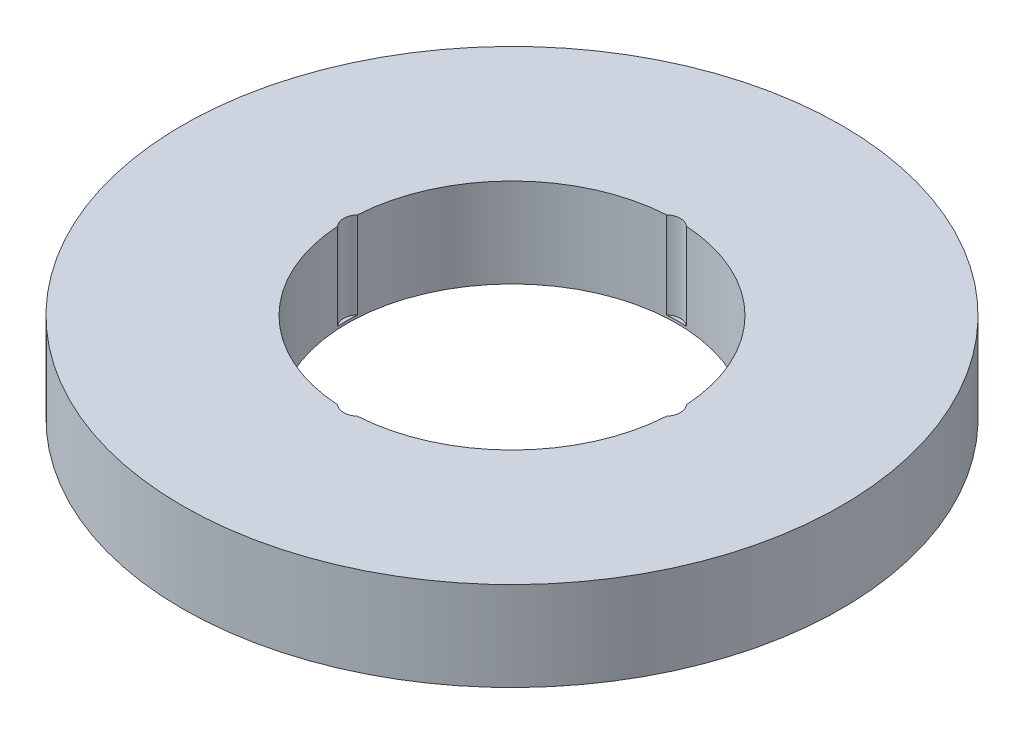
from build123d import *

# Parameters (mm, degrees)
SKETCH1_R           = 85
BOSS_EXTRUDE1_DEPTH = 23
SKETCH2_R           = 42.5
CUT_EXTRUDE1_DEPTH  = 123.388724971
SKETCH3_R           = 3.798967834
CUT_EXTRUDE2_DEPTH  = 22.342272053
CIRPATTERN1_COUNT   = 4


with BuildPart() as part:
    # Sketch1 → Boss-Extrude1 (new body)
    with BuildSketch(Plane(origin=(0, 0, 0), x_dir=(1, 0, 0), z_dir=(0, 1, 0))):
        Circle(SKETCH1_R)
    extrude(amount=BOSS_EXTRUDE1_DEPTH)

    # Sketch2 → Cut-Extrude1 (cut, through all)
    with BuildSketch(Plane(origin=(0, 0, 0), x_dir=(1, 0, 0), z_dir=(0, 1, 0))):
        Circle(SKETCH2_R)
    extrude(amount=CUT_EXTRUDE1_DEPTH, mode=Mode.SUBTRACT)

    # Sketch3 → Cut-Extrude2 (cut)
    with BuildSketch(Plane(origin=(0, 23, 0), x_dir=(1, 0, 0), z_dir=(0, 1, 0))):
        with Locations((-39.60595489, 0)):
            Circle(SKETCH3_R)
    cut_extrude2 = extrude(amount=-CUT_EXTRUDE2_DEPTH, mode=Mode.SUBTRACT)

    # CirPattern1: Cut-Extrude2 ×4 about axis
    cirpattern1_axis = Axis((0, 0, 0), (0, 1, 0))
    for i in range(1, CIRPATTERN1_COUNT):
        add(cut_extrude2.rotate(cirpattern1_axis, i * 360 / CIRPATTERN1_COUNT), mode=Mode.SUBTRACT)


solid = part.part
